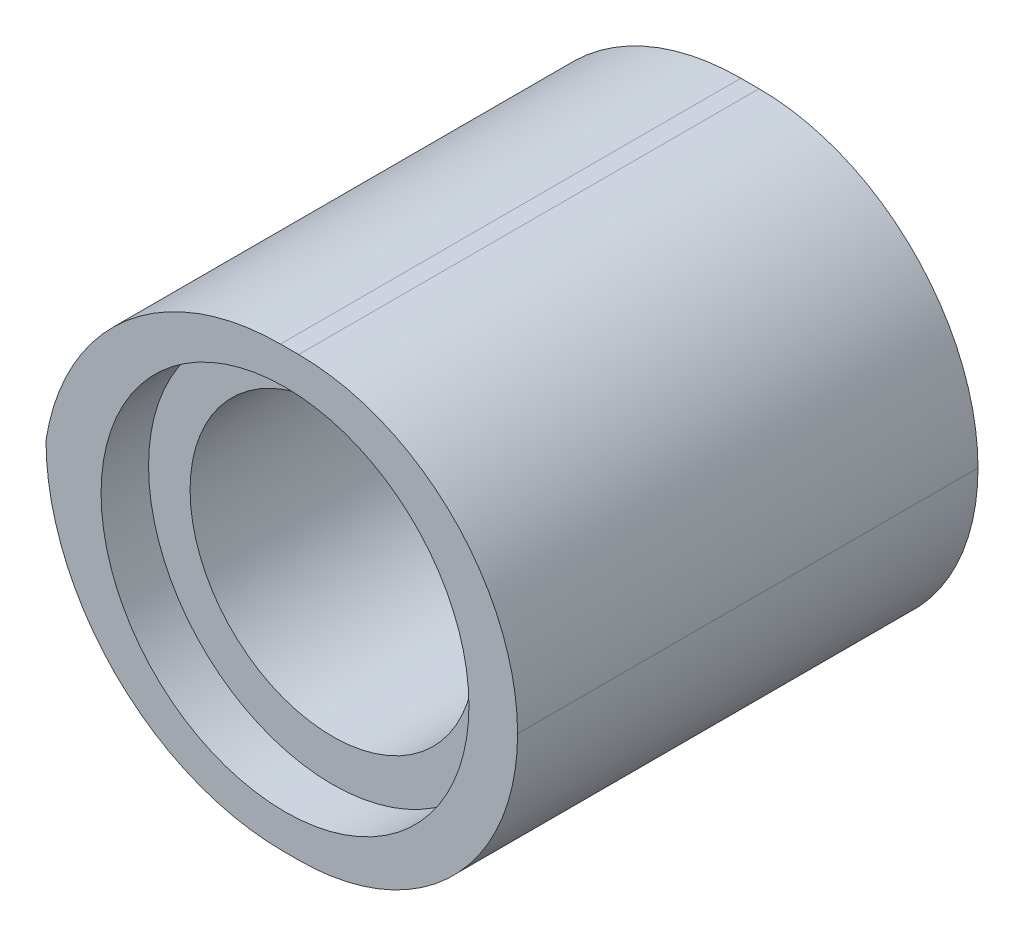
from build123d import *

# Parameters (mm, degrees)
SKETCH1_W                = 39
SKETCH1_H                = 7.38
BOSS_EXTRUDE1_DEPTH      = 7.76
SKETCH2_R                = 2.4
CUT_EXTRUDE1_DEPTH       = 7.76
CUT_EXTRUDE2_OUTLINE_R   = 3.1
CUT_EXTRUDE2_OUTLINE_R_2 = 2.4
CUT_EXTRUDE2_DEPTH       = 0.8
CUT_EXTRUDE3_START       = 6.96
CUT_EXTRUDE3_OUTLINE_R   = 3.1
CUT_EXTRUDE3_OUTLINE_R_2 = 2.4
CUT_EXTRUDE3_DEPTH       = 0.8
LPATTERN3_COUNT          = 3
LPATTERN3_PITCH          = 7.79
LPATTERN6_COUNT          = 3
LPATTERN6_PITCH          = 7.79
FILLET1_R                = 3.69
FILLET2_R                = 3.69
FILLET3_R                = 3.69
FILLET4_R                = 3.69
SKETCH4_W                = 32.047846992
SKETCH4_H                = 7.400170021
CUT_EXTRUDE4_DEPTH       = 10
FILLET6_R                = 4
FILLET7_R                = 4
BOSS_EXTRUDE2_START      = -0.8
BOSS_EXTRUDE2_OUTLINE_R  = 3.1
BOSS_EXTRUDE2_DEPTH      = 0.8


with BuildPart() as part:
    # Sketch1 → Boss-Extrude1 (new body)
    with BuildSketch(Plane.XY):
        with Locations((19.5, 3.69)):
            Rectangle(SKETCH1_W, SKETCH1_H)
    extrude(amount=BOSS_EXTRUDE1_DEPTH)

    # Sketch2 → Cut-Extrude1 (cut)
    with BuildSketch(Plane.XY.offset(7.76)):
        with Locations((19.5, 3.69)):
            Circle(SKETCH2_R)
    cut_extrude1 = extrude(amount=-CUT_EXTRUDE1_DEPTH, mode=Mode.SUBTRACT)

    # Cut-Extrude2: read off the stored shape, not the designer's step
    # Cut-Extrude2 outline → Cut-Extrude2 (cut)
    with BuildSketch(Plane.XY):
        with Locations((19.5, 3.69)):
            Circle(CUT_EXTRUDE2_OUTLINE_R)
        with Locations((19.5, 3.69)):
            Circle(CUT_EXTRUDE2_OUTLINE_R_2, mode=Mode.SUBTRACT)
    cut_extrude2 = extrude(amount=CUT_EXTRUDE2_DEPTH, mode=Mode.SUBTRACT)

    # Cut-Extrude3: read off the stored shape, not the designer's step
    # Cut-Extrude3 outline → Cut-Extrude3 (cut)
    with BuildSketch(Plane.XY.offset(CUT_EXTRUDE3_START)):
        with Locations((19.5, 3.69)):
            Circle(CUT_EXTRUDE3_OUTLINE_R)
        with Locations((19.5, 3.69)):
            Circle(CUT_EXTRUDE3_OUTLINE_R_2, mode=Mode.SUBTRACT)
    cut_extrude3 = extrude(amount=CUT_EXTRUDE3_DEPTH, mode=Mode.SUBTRACT)

    # LPattern3: Cut-Extrude1, Cut-Extrude2, Cut-Extrude3 ×3
    with Locations(*[(-i * LPATTERN3_PITCH, 0, 0) for i in range(1, LPATTERN3_COUNT)]):
        add(cut_extrude1, mode=Mode.SUBTRACT)
        add(cut_extrude2, mode=Mode.SUBTRACT)
        add(cut_extrude3, mode=Mode.SUBTRACT)

    # LPattern6: Cut-Extrude1, Cut-Extrude2, Cut-Extrude3 ×3
    with Locations(*[(i * LPATTERN6_PITCH, 0, 0) for i in range(1, LPATTERN6_COUNT)]):
        add(cut_extrude1, mode=Mode.SUBTRACT)
        add(cut_extrude2, mode=Mode.SUBTRACT)
        add(cut_extrude3, mode=Mode.SUBTRACT)

    # Fillet1
    fillet1_edges = [part.edges().sort_by_distance(p)[0] for p in [
        (0, 7.38, 3.88),
    ]]
    fillet(fillet1_edges, radius=FILLET1_R)

    # Fillet2
    fillet2_edges = [part.edges().sort_by_distance(p)[0] for p in [
        (0, 0, 3.88),
    ]]
    fillet(fillet2_edges, radius=FILLET2_R - 0.0001)  # a hair under: the kernel refuses the full size

    # Fillet3
    fillet3_edges = [part.edges().sort_by_distance(p)[0] for p in [
        (39, 7.38, 3.88),
    ]]
    fillet(fillet3_edges, radius=FILLET3_R)

    # Fillet4
    fillet4_edges = [part.edges().sort_by_distance(p)[0] for p in [
        (39, 0, 3.88),
    ]]
    fillet(fillet4_edges, radius=FILLET4_R - 0.0001)  # a hair under: the kernel refuses the full size

    # Sketch4 → Cut-Extrude4 (cut)
    with BuildSketch(Plane(origin=(0, 0, 0), x_dir=(-1, 0, 0), z_dir=(0, 0, -1))):
        with Locations((-15.027741002, 3.700085011)):
            Rectangle(SKETCH4_W, SKETCH4_H)
    extrude(amount=-CUT_EXTRUDE4_DEPTH, mode=Mode.SUBTRACT)

    # Fillet6
    fillet6_edges = [part.edges().sort_by_distance(p)[0] for p in [
        (31.051664498, 0, 3.88),
    ]]
    fillet(fillet6_edges, radius=FILLET6_R)

    # Fillet7
    # the kernel refuses this fillet: 4 mm, written as the material it takes off along each edge
    with BuildSketch(Plane(origin=(31.051664498, 7.38, -9.8791447), x_dir=(0, -1, 0), z_dir=(0, 0, 1))) as fillet7_piece_1:
        with BuildLine():
            CenterArc((4, 3.95165788), FILLET7_R, 180, 81.083203747)
            Line((0, 3.95165788), (-0.08, 3.95165788))
            Line((-0.08, 3.95165788), (-0.08, 0))
            Line((-0.08, 0), (0, -0.08))
            ThreePointArc((0, -0.08), (1.69, -0.08), (3.3676, -0.079033158))
            Line((3.3676, -0.079033158), (3.38, 0))
        make_face()
    extrude(amount=27.5182894, mode=Mode.SUBTRACT)

    # Boss-Extrude2: read off the stored shape, not the designer's step
    # Boss-Extrude2 outline → Boss-Extrude2 (add)
    with BuildSketch(Plane(origin=(0, 0, 0), x_dir=(-1, 0, 0), z_dir=(0, 0, -1)).offset(BOSS_EXTRUDE2_START)):
        with Locations((-35.08, 3.69)):
            Circle(BOSS_EXTRUDE2_OUTLINE_R)
    extrude(amount=BOSS_EXTRUDE2_DEPTH)


solid = part.part
